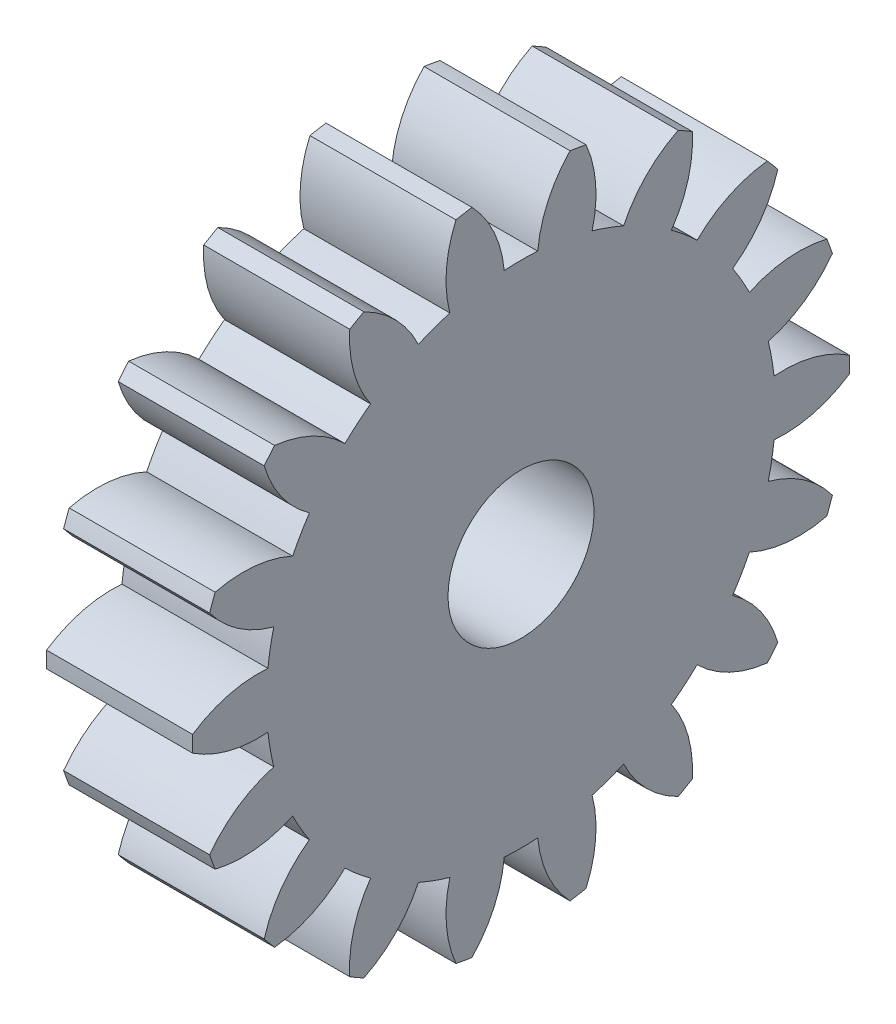
from build123d import *

# Parameters (mm, degrees)
BASPROSKE_W     = 5
BASPROSKE_H     = 11.25
TOOTHCUT_DEPTH  = 17.67708008
TEETHCUTS_COUNT = 18
TEETHCUTS_ANGLE = 340
BORSKE_R        = 2.5
BORE_DEPTH      = 50.0000508


with BuildPart() as part:
    # BasProSke → Base-Revolve (revolve)
    with BuildSketch(Plane(origin=(0, 0, 0), x_dir=(1, 0, 0), z_dir=(0, 1, 0))):
        with Locations((2.5, 5.625)):
            Rectangle(BASPROSKE_W, BASPROSKE_H)
    revolve(axis=Axis((-10, 0, 0), (1, 0, 0)))

    # TooCutSke → ToothCut (cut, through all)
    with BuildSketch(Plane(origin=(0, 0, 0), x_dir=(0, 0, -1), z_dir=(1, 0, 0))):
        with BuildLine():
            ThreePointArc((0.573352044, 8.698875358), (0, 8.71775), (-0.573352044, 8.698875358))
            ThreePointArc((-0.573352044, 8.698875358), (-0.927373593, 10.019142299), (-1.700441513, 11.146440859))
            ThreePointArc((-1.700441513, 11.146440859), (0, 11.2754), (1.700441513, 11.146440859))
            ThreePointArc((1.700441513, 11.146440859), (0.927373593, 10.019142299), (0.573352044, 8.698875358))
        make_face()
    toothcut = extrude(amount=TOOTHCUT_DEPTH, mode=Mode.SUBTRACT)

    # TeethCuts: ToothCut ×18 about axis
    teethcuts_axis = Axis((-10, 0, 0), (1, 0, 0))
    for i in range(1, TEETHCUTS_COUNT):
        add(toothcut.rotate(teethcuts_axis, i * TEETHCUTS_ANGLE / (TEETHCUTS_COUNT - 1)), mode=Mode.SUBTRACT)

    # BorSke → Bore (cut, symmetric)
    with BuildSketch(Plane(origin=(0, 0, 0), x_dir=(0, 0, -1), z_dir=(1, 0, 0))):
        Circle(BORSKE_R)
    extrude(amount=BORE_DEPTH, both=True, mode=Mode.SUBTRACT)


solid = part.part
